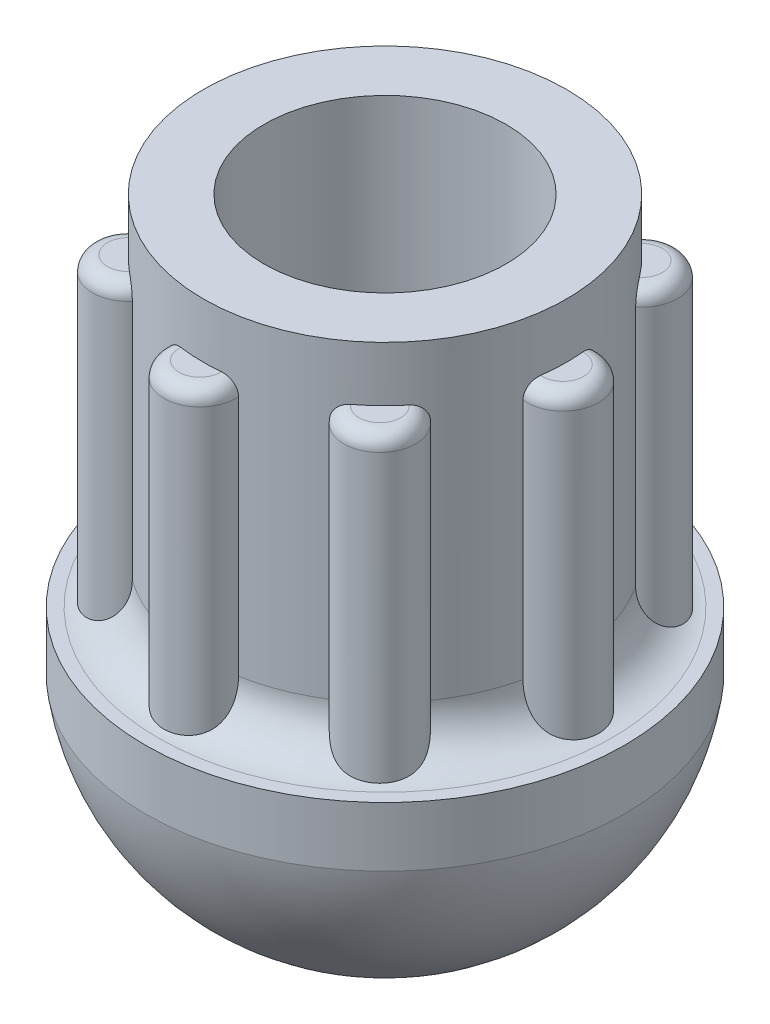
from build123d import *

# Parameters (mm, degrees)
SKETCH2_R           = 1.186722436
BOSS_EXTRUDE1_DEPTH = 10
FILLET1_R           = 0.5


with BuildPart() as part:
    # Sketch1 → Revolve1 (revolve)
    with BuildSketch(Plane.XY):
        with BuildLine():
            Line((0, 0), (0, 8.82467879))
            Line((0, 8.82467879), (2.5, 8.82467879))
            ThreePointArc((2.5, 8.82467879), (3.560660172, 9.264018618), (4, 10.32467879))
            Line((4, 10.32467879), (4, 20.6375))
            Line((4, 20.6375), (6, 20.6375))
            Line((6, 20.6375), (6, 10.32467879))
            ThreePointArc((6, 10.32467879), (6.439339828, 9.264018618), (7.5, 8.82467879))
            Line((7.5, 8.82467879), (7.918196819, 8.82467879))
            Line((7.918196819, 8.82467879), (7.918196819, 6.858878126))
            ThreePointArc((7.918196819, 6.858878126), (5.237891991, 1.953142345), (0, 0))
        make_face()
    revolve(axis=Axis((0, 0, 0), (0, 1, 0)))

    # Sketch2 → Boss-Extrude1 (add)
    with BuildSketch(Plane(origin=(0, 8.82467879, 0), x_dir=(1, 0, 0), z_dir=(0, 1, 0))):
        with Locations((0.118945018, 5.998820891)):
            Circle(SKETCH2_R)
        with Locations((4.32591376, 4.157700103)):
            Circle(SKETCH2_R)
        with Locations((5.998820891, -0.118945018)):
            Circle(SKETCH2_R)
        with Locations((4.157700103, -4.32591376)):
            Circle(SKETCH2_R)
        with Locations((-0.118945018, -5.998820891)):
            Circle(SKETCH2_R)
        with Locations((-4.32591376, -4.157700103)):
            Circle(SKETCH2_R)
        with Locations((-5.998820891, 0.118945018)):
            Circle(SKETCH2_R)
        with Locations((-4.157700103, 4.32591376)):
            Circle(SKETCH2_R)
    extrude(amount=BOSS_EXTRUDE1_DEPTH)

    # Fillet1
    fillet1_edges = [part.edges().sort_by_distance(p)[0] for p in [
        (-5.181523579, 18.82467879, 4.980039435),
        (-7.185310114, 18.82467879, -0.142470804),
        (-4.980039435, 18.82467879, -5.181523579),
        (0.142470804, 18.82467879, -7.185310114),
        (-0.142470804, 18.82467879, 7.185310114),
        (4.980039435, 18.82467879, 5.181523579),
        (5.181523579, 18.82467879, -4.980039435),
        (7.185310114, 18.82467879, 0.142470804),
    ]]
    fillet(fillet1_edges, radius=FILLET1_R)


solid = part.part
